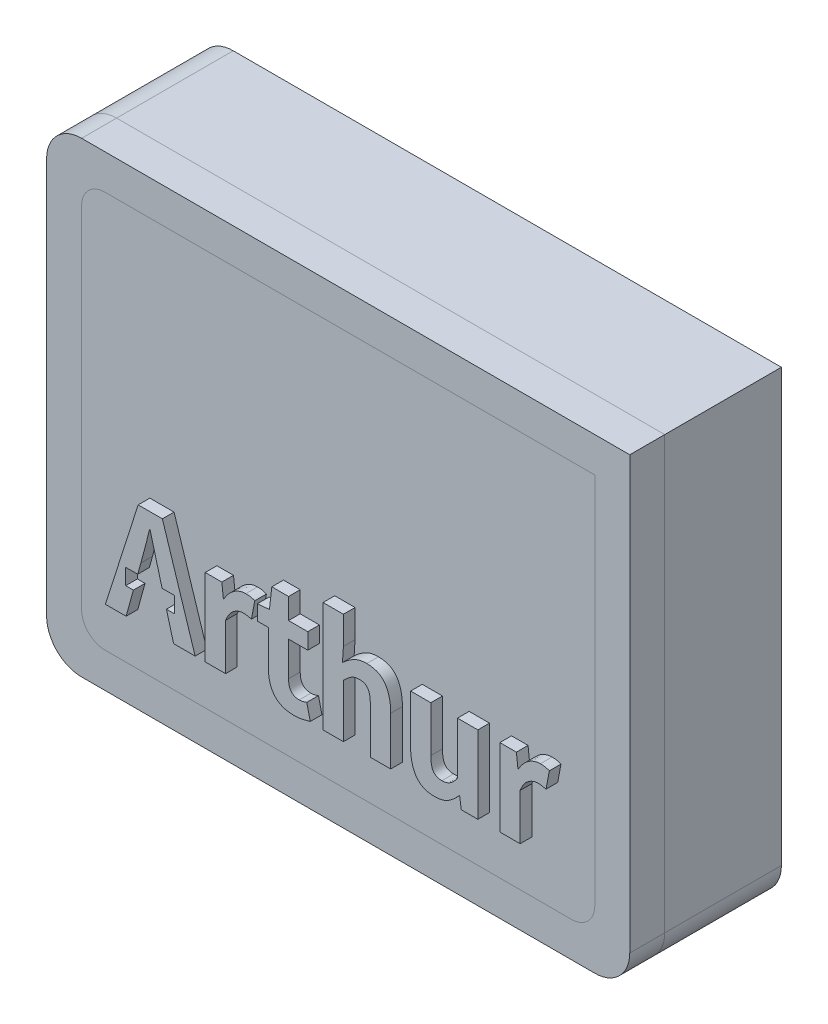
from build123d import *

# Parameters (mm, degrees)
SKETCH1_W           = 40
SKETCH1_H           = 50
BOSS_EXTRUDE1_DEPTH = 10
FILLET1_R           = 3
BOSS_EXTRUDE6_DEPTH = 3
BOSS_EXTRUDE7_DEPTH = 3
BOSS_EXTRUDE8_DEPTH = 1


# Read off the part's stored shape, not the designer's step: Boss-Extrude8
with BuildPart() as part:
    # Sketch1 → Boss-Extrude1 (new body)
    with BuildSketch(Plane(origin=(0, 0, 0), x_dir=(0, 1, 0), z_dir=(0, 0, 1))):
        with Locations((20, 25)):
            Rectangle(SKETCH1_W, SKETCH1_H)
    extrude(amount=BOSS_EXTRUDE1_DEPTH)

    # Fillet1
    fillet1_edges = [part.edges().sort_by_distance(p)[0] for p in [
        (-50, 0, 5),
        (-50, 40, 5),
        (0, 0, 5),
    ]]
    fillet(fillet1_edges, radius=FILLET1_R)

    # Sketch6 → Boss-Extrude6 (add)
    with BuildSketch(Plane.XY.offset(10)):
        with BuildLine():
            Line((-45, 3), (-5, 3))
            ThreePointArc((-5, 3), (-3.585786438, 3.585786438), (-3, 5))
            Line((-3, 5), (-3, 37))
            Line((-3, 37), (-45, 37))
            ThreePointArc((-45, 37), (-46.414213562, 36.414213562), (-47, 35))
            Line((-47, 35), (-47, 5))
            ThreePointArc((-47, 5), (-46.414213562, 3.585786438), (-45, 3))
        make_face()
    extrude(amount=BOSS_EXTRUDE6_DEPTH)


with BuildPart() as body_2:
    # Sketch7 → Boss-Extrude7 (new body)
    with BuildSketch(Plane.XY.offset(10)):
        with BuildLine():
            Line((-47, 0), (-3, 0))
            ThreePointArc((-3, 0), (-0.878679656, 0.878679656), (0, 3))
            Line((0, 3), (0, 40))
            Line((0, 40), (-47, 40))
            ThreePointArc((-47, 40), (-49.121320344, 39.121320344), (-50, 37))
            Line((-50, 37), (-50, 3))
            ThreePointArc((-50, 3), (-49.121320344, 0.878679656), (-47, 0))
        make_face()
        with BuildLine():
            Line((-3, 5), (-3, 37))
            Line((-3, 37), (-45, 37))
            ThreePointArc((-45, 37), (-46.414213562, 36.414213562), (-47, 35))
            Line((-47, 35), (-47, 5))
            ThreePointArc((-47, 5), (-46.414213562, 3.585786438), (-45, 3))
            Line((-45, 3), (-5, 3))
            ThreePointArc((-5, 3), (-3.585786438, 3.585786438), (-3, 5))
        make_face(mode=Mode.SUBTRACT)
    extrude(amount=BOSS_EXTRUDE7_DEPTH)


with BuildPart() as body_3:
    # Boss-Extrude8 outline → Boss-Extrude8 (new body)
    with BuildSketch(Plane.XY.offset(13)):
        with BuildLine():
            add(Edge.make_bspline(
                [(-6.89259969, 12.683152397), (-6.957017269, 12.679193738), (-7.089762106, 12.671036157), (-7.290146291, 12.611818206), (-7.49488722, 12.518034298), (-7.664561696, 12.410834155), (-7.799972781, 12.306065125), (-7.898935555, 12.211405082), (-7.993547787, 12.104607593), (-8.083185726, 11.984985562), (-8.168877104, 11.852405348), (-8.25088534, 11.706914177), (-8.328451971, 11.54805463), (-8.375081751, 11.436560042), (-8.399107037, 11.379114147)],
                knots=[0, 0, 0, 0, 0.091376318, 0.188298514, 0.294403757, 0.410422197, 0.472306677, 0.537207096, 0.604501323, 0.674654277, 0.749199374, 0.828459493, 0.911616356, 1, 1, 1, 1], degree=3))
            add(Edge.make_bspline(
                [(-6.180526171, 12.576770329), (-6.240494508, 12.591469924), (-6.353200575, 12.619096729), (-6.521710362, 12.653769633), (-6.698887795, 12.682154006), (-6.823816203, 12.682797887), (-6.89259969, 12.683152397)],
                knots=[0, 0, 0, 0, 0.256421959, 0.481926164, 0.714757235, 1, 1, 1, 1], degree=3))
            Line((-6.180526171, 12.576770329), (-5.895696764, 14.083277677))
            add(Edge.make_bspline(
                [(-6.667824676, 14.223976541), (-6.622611771, 14.224067447), (-6.536667113, 14.22424025), (-6.415463178, 14.214314223), (-6.307848393, 14.204396406), (-6.186006865, 14.17753054), (-6.048099991, 14.14285352), (-5.9451247, 14.102599518), (-5.895696764, 14.083277677)],
                knots=[0, 0, 0, 0, 0.17145188, 0.325910789, 0.461312007, 0.580904183, 0.798834836, 1, 1, 1, 1], degree=3))
            add(Edge.make_bspline(
                [(-8.55353262, 12.883905654), (-8.491634198, 12.987719078), (-8.371449665, 13.189287509), (-8.160741743, 13.459341734), (-7.935650026, 13.692177857), (-7.694342299, 13.882977504), (-7.444953348, 14.035867782), (-7.188237631, 14.142275835), (-6.929553112, 14.212910696), (-6.754629434, 14.220306447), (-6.667824676, 14.223976541)],
                knots=[0, 0, 0, 0, 0.149517752, 0.290309843, 0.423005613, 0.549519039, 0.670229853, 0.783853867, 0.892738861, 1, 1, 1, 1], degree=3))
            Line((-8.55353262, 12.883905654), (-8.587849416, 12.883905654))
            Line((-8.587849416, 12.883905654), (-8.719969081, 14.05925592))
            Line((-8.719969081, 14.05925592), (-10.142400278, 14.05925592))
            Line((-10.142400278, 14.05925592), (-10.142400278, 7.41724004))
            Line((-10.142400278, 7.41724004), (-8.399107037, 7.41724004))
            Line((-8.399107037, 7.41724004), (-8.399107037, 11.379114147))
        make_face()
        with BuildLine():
            add(Edge.make_bspline(
                [(-13.627270918, 8.37811033), (-13.698752826, 8.296393984), (-13.839234919, 8.135798335), (-14.066432442, 7.917006687), (-14.303819942, 7.724600401), (-14.550080163, 7.555409683), (-14.813339449, 7.415339696), (-15.101739469, 7.320895383), (-15.412618358, 7.26004457), (-15.628207662, 7.253949265), (-15.739469717, 7.250803579)],
                knots=[0, 0, 0, 0, 0.131190441, 0.257826187, 0.380697838, 0.50015742, 0.618586318, 0.739702794, 0.86566494, 1, 1, 1, 1], degree=3))
            Line((-13.627270918, 8.37811033), (-13.580943244, 8.37811033))
            Line((-13.580943244, 8.37811033), (-13.450539419, 7.41724004))
            Line((-13.450539419, 7.41724004), (-12.026392382, 7.41724004))
            Line((-12.026392382, 7.41724004), (-12.026392382, 14.05925592))
            Line((-12.026392382, 14.05925592), (-13.769685622, 14.05925592))
            Line((-13.769685622, 14.05925592), (-13.769685622, 9.575766513))
            add(Edge.make_bspline(
                [(-15.109756509, 8.745300048), (-15.044328156, 8.747236173), (-14.916883231, 8.751007461), (-14.733079868, 8.791199269), (-14.560503919, 8.850248349), (-14.399107008, 8.939095595), (-14.243706033, 9.056759591), (-14.086526413, 9.201119822), (-13.926219225, 9.376395885), (-13.823700558, 9.506969837), (-13.769685622, 9.575766513)],
                knots=[0, 0, 0, 0, 0.119252017, 0.2322856, 0.341921475, 0.451248669, 0.56693707, 0.697010787, 0.840361338, 1, 1, 1, 1], degree=3))
            add(Edge.make_bspline(
                [(-16.05861592, 10.133414449), (-16.058023989, 10.071625398), (-16.056883081, 9.952531199), (-16.046383946, 9.781371519), (-16.030425261, 9.624137616), (-16.003804738, 9.482401099), (-15.974549434, 9.353706225), (-15.933967858, 9.240762934), (-15.89116144, 9.139677685), (-15.836478831, 9.054556339), (-15.775322961, 8.980179059), (-15.704864672, 8.917329474), (-15.626844104, 8.862925157), (-15.539688286, 8.820401817), (-15.444500843, 8.785289539), (-15.34003775, 8.762135965), (-15.227371832, 8.748421199), (-15.149833697, 8.746363574), (-15.109756509, 8.745300048)],
                knots=[0, 0, 0, 0, 0.095693767, 0.184443237, 0.265545572, 0.34026652, 0.407734768, 0.469652883, 0.525961664, 0.577328674, 0.625762458, 0.674687968, 0.72309744, 0.772620839, 0.824466896, 0.879911875, 0.93792997, 1, 1, 1, 1], degree=3))
            Line((-16.05861592, 10.133414449), (-16.05861592, 14.05925592))
            Line((-16.05861592, 14.05925592), (-17.789898282, 14.05925592))
            Line((-17.789898282, 14.05925592), (-17.789898282, 9.918934474))
            add(Edge.make_bspline(
                [(-15.739469717, 7.250803579), (-15.826544304, 7.252295726), (-15.995137063, 7.255184803), (-16.238095823, 7.29111523), (-16.462962088, 7.344663589), (-16.669421832, 7.422451203), (-16.857268872, 7.522377471), (-17.028359981, 7.643130973), (-17.177832204, 7.788956893), (-17.309505003, 7.955346532), (-17.421422644, 8.142432575), (-17.522170411, 8.344847845), (-17.603271497, 8.566402406), (-17.672342183, 8.803563438), (-17.725181112, 9.058340653), (-17.761700427, 9.330148669), (-17.787231053, 9.618750914), (-17.788993171, 9.817068655), (-17.789898282, 9.918934474)],
                knots=[0, 0, 0, 0, 0.06794897, 0.13156197, 0.191364378, 0.248193502, 0.303345965, 0.35714136, 0.411160683, 0.465853587, 0.522390547, 0.581122383, 0.642186012, 0.706365777, 0.773909781, 0.845166862, 0.920470028, 1, 1, 1, 1], degree=3))
        make_face()
        with BuildLine():
            add(Edge.make_bspline(
                [(-22.177300659, 12.731195912), (-22.242711742, 12.729126624), (-22.370009185, 12.725099554), (-22.554290679, 12.686737064), (-22.727869913, 12.630347155), (-22.888566262, 12.541996693), (-23.045221356, 12.43190306), (-23.207660539, 12.302601303), (-23.380515904, 12.153172855), (-23.493988041, 12.041541848), (-23.553404182, 11.983089757)],
                knots=[0, 0, 0, 0, 0.121414917, 0.236287304, 0.348567784, 0.45937419, 0.57555246, 0.704219947, 0.845124013, 1, 1, 1, 1], degree=3))
            add(Edge.make_bspline(
                [(-21.240452127, 11.343081511), (-21.241065675, 11.404866427), (-21.242248247, 11.523952658), (-21.252460515, 11.695167203), (-21.26936722, 11.852119876), (-21.292818833, 11.994361744), (-21.323557207, 12.122342552), (-21.361037245, 12.236192347), (-21.405019296, 12.336138812), (-21.457013923, 12.42262734), (-21.518741558, 12.494979492), (-21.585651146, 12.560381334), (-21.663511507, 12.612862092), (-21.749366292, 12.656634637), (-21.843828159, 12.690807711), (-21.947519603, 12.714620788), (-22.059700251, 12.72802115), (-22.137228553, 12.730114118), (-22.177300659, 12.731195912)],
                knots=[0, 0, 0, 0, 0.09606466, 0.185158109, 0.266574784, 0.341432292, 0.409162037, 0.471033178, 0.527560202, 0.578656355, 0.62727786, 0.675087378, 0.723684477, 0.772605992, 0.824652996, 0.879446433, 0.937689396, 1, 1, 1, 1], degree=3))
            Line((-21.240452127, 11.343081511), (-21.240452127, 7.41724004))
            Line((-21.240452127, 7.41724004), (-19.497158886, 7.41724004))
            Line((-19.497158886, 7.41724004), (-19.497158886, 11.555845646))
            add(Edge.make_bspline(
                [(-21.549303291, 14.223976541), (-21.462232336, 14.222475563), (-21.293646608, 14.219569387), (-21.050638664, 14.183758555), (-20.82542209, 14.129669703), (-20.618364624, 14.053226713), (-20.431221906, 13.951835327), (-20.260416472, 13.831700435), (-20.11079448, 13.685893315), (-19.979680812, 13.518855388), (-19.8648156, 13.333405652), (-19.767567573, 13.128989358), (-19.683446251, 12.909353636), (-19.614370536, 12.671842253), (-19.562089096, 12.416974569), (-19.525316768, 12.144637227), (-19.499837008, 11.856027632), (-19.498067694, 11.657710931), (-19.497158886, 11.555845646)],
                knots=[0, 0, 0, 0, 0.067933396, 0.131531816, 0.191320516, 0.248554547, 0.303300528, 0.357083592, 0.411090534, 0.465770902, 0.522529054, 0.581051804, 0.642259671, 0.70599592, 0.773961602, 0.84520235, 0.920488256, 1, 1, 1, 1], degree=3))
            add(Edge.make_bspline(
                [(-23.635764492, 13.252811212), (-23.568992742, 13.314819481), (-23.433939969, 13.440237622), (-23.21599825, 13.615176064), (-22.981519284, 13.777173354), (-22.735742539, 13.932168154), (-22.470899212, 14.06509409), (-22.181764044, 14.15775855), (-21.872317355, 14.213409934), (-21.658782674, 14.220395193), (-21.549303291, 14.223976541)],
                knots=[0, 0, 0, 0, 0.115619274, 0.233851947, 0.354265795, 0.477139709, 0.602442212, 0.72914752, 0.86113374, 1, 1, 1, 1], degree=3))
            Line((-23.635764492, 13.252811212), (-23.553404182, 14.49679507))
            Line((-23.553404182, 14.49679507), (-23.553404182, 16.881812396))
            Line((-23.553404182, 16.881812396), (-25.296697422, 16.881812396))
            Line((-25.296697422, 16.881812396), (-25.296697422, 7.41724004))
            Line((-25.296697422, 7.41724004), (-23.553404182, 7.41724004))
            Line((-23.553404182, 7.41724004), (-23.553404182, 11.983089757))
        make_face()
        with BuildLine():
            add(Edge.make_bspline(
                [(-26.394834896, 7.499600351), (-26.491965802, 7.471801335), (-26.698586568, 7.41266615), (-26.965830719, 7.342708048), (-27.200795131, 7.294246457), (-27.392893763, 7.269416253), (-27.596224044, 7.253505056), (-27.735445784, 7.251720432), (-27.806971054, 7.250803579)],
                knots=[0, 0, 0, 0, 0.210487011, 0.447756428, 0.575349219, 0.709996817, 0.851010652, 1, 1, 1, 1], degree=3))
            Line((-26.394834896, 7.499600351), (-26.691675182, 8.769321805))
            add(Edge.make_bspline(
                [(-27.343694308, 8.626907102), (-27.287474319, 8.62942563), (-27.171776943, 8.634608612), (-27.001532055, 8.670669991), (-26.840980764, 8.717724107), (-26.739035096, 8.752954952), (-26.691675182, 8.769321805)],
                knots=[0, 0, 0, 0, 0.251439997, 0.517448487, 0.775825707, 1, 1, 1, 1], degree=3))
            add(Edge.make_bspline(
                [(-28.258236923, 9.742202974), (-28.255546346, 9.653336312), (-28.250490327, 9.486341773), (-28.206624461, 9.25389291), (-28.134242535, 9.056884048), (-28.028818706, 8.896592679), (-27.893948214, 8.773589562), (-27.731983075, 8.688151449), (-27.54599851, 8.635249894), (-27.413278045, 8.629776655), (-27.343694308, 8.626907102)],
                knots=[0, 0, 0, 0, 0.161917533, 0.304268702, 0.429383006, 0.542186936, 0.650710857, 0.758495674, 0.873382197, 1, 1, 1, 1], degree=3))
            Line((-28.258236923, 9.742202974), (-28.258236923, 12.683152397))
            Line((-28.258236923, 12.683152397), (-26.609314872, 12.683152397))
            Line((-26.609314872, 12.683152397), (-26.609314872, 14.05925592))
            Line((-26.609314872, 14.05925592), (-28.258236923, 14.05925592))
            Line((-28.258236923, 14.05925592), (-28.258236923, 15.848876835))
            Line((-28.258236923, 15.848876835), (-29.692678998, 15.848876835))
            Line((-29.692678998, 15.848876835), (-29.895148095, 14.05925592))
            Line((-29.895148095, 14.05925592), (-30.926367817, 13.975179769))
            Line((-30.926367817, 13.975179769), (-30.926367817, 12.683152397))
            Line((-30.926367817, 12.683152397), (-29.989519284, 12.683152397))
            Line((-29.989519284, 12.683152397), (-29.989519284, 9.730192095))
            add(Edge.make_bspline(
                [(-27.806971054, 7.250803579), (-27.870472757, 7.25195887), (-27.994765988, 7.254220146), (-28.177188434, 7.267013075), (-28.350090956, 7.293314677), (-28.513867356, 7.327830927), (-28.669040189, 7.369223443), (-28.813368529, 7.42556031), (-28.949981484, 7.488458716), (-29.117668298, 7.586318489), (-29.306693681, 7.730722003), (-29.500075982, 7.937384773), (-29.661537779, 8.172057817), (-29.784563691, 8.438676789), (-29.875256404, 8.730077468), (-29.942381425, 9.043604756), (-29.981710013, 9.379734747), (-29.986866049, 9.611122615), (-29.989519284, 9.730192095)],
                knots=[0, 0, 0, 0, 0.050409548, 0.098667678, 0.145021988, 0.18909492, 0.231499619, 0.272306833, 0.311909423, 0.350763364, 0.426217389, 0.499762626, 0.57455825, 0.651322874, 0.731865898, 0.816364893, 0.90550353, 1, 1, 1, 1], degree=3))
        make_face()
        with BuildLine():
            add(Edge.make_bspline(
                [(-32.149761597, 12.683152397), (-32.214179176, 12.679193738), (-32.346924013, 12.671036157), (-32.547308199, 12.611818206), (-32.752049127, 12.518034298), (-32.921723603, 12.410834155), (-33.057134688, 12.306065125), (-33.156097463, 12.211405082), (-33.250709694, 12.104607593), (-33.340347633, 11.984985562), (-33.426039012, 11.852405348), (-33.508047247, 11.706914177), (-33.585613878, 11.54805463), (-33.632243658, 11.436560042), (-33.656268945, 11.379114147)],
                knots=[0, 0, 0, 0, 0.091376318, 0.188298514, 0.294403757, 0.410422197, 0.472306677, 0.537207096, 0.604501323, 0.674654277, 0.749199374, 0.828459493, 0.911616356, 1, 1, 1, 1], degree=3))
            add(Edge.make_bspline(
                [(-31.437688079, 12.576770329), (-31.497656415, 12.591469924), (-31.610362483, 12.619096729), (-31.77887227, 12.653769633), (-31.956049702, 12.682154006), (-32.080978111, 12.682797887), (-32.149761597, 12.683152397)],
                knots=[0, 0, 0, 0, 0.256421959, 0.481926164, 0.714757235, 1, 1, 1, 1], degree=3))
            Line((-31.437688079, 12.576770329), (-31.152858671, 14.083277677))
            add(Edge.make_bspline(
                [(-31.924986583, 14.223976541), (-31.879773679, 14.224067447), (-31.793829021, 14.22424025), (-31.672625085, 14.214314223), (-31.5650103, 14.204396406), (-31.443168773, 14.17753054), (-31.305261898, 14.14285352), (-31.202286607, 14.102599518), (-31.152858671, 14.083277677)],
                knots=[0, 0, 0, 0, 0.17145188, 0.325910789, 0.461312007, 0.580904183, 0.798834836, 1, 1, 1, 1], degree=3))
            add(Edge.make_bspline(
                [(-33.810694527, 12.883905654), (-33.748796105, 12.987719078), (-33.628611572, 13.189287509), (-33.41790365, 13.459341734), (-33.192811933, 13.692177857), (-32.951504206, 13.882977504), (-32.702115255, 14.035867782), (-32.445399539, 14.142275835), (-32.186715019, 14.212910696), (-32.011791341, 14.220306447), (-31.924986583, 14.223976541)],
                knots=[0, 0, 0, 0, 0.149517752, 0.290309843, 0.423005613, 0.549519039, 0.670229853, 0.783853867, 0.892738861, 1, 1, 1, 1], degree=3))
            Line((-33.810694527, 12.883905654), (-33.845011323, 12.883905654))
            Line((-33.845011323, 12.883905654), (-33.977130988, 14.05925592))
            Line((-33.977130988, 14.05925592), (-35.399562185, 14.05925592))
            Line((-35.399562185, 14.05925592), (-35.399562185, 7.41724004))
            Line((-35.399562185, 7.41724004), (-33.656268945, 7.41724004))
            Line((-33.656268945, 7.41724004), (-33.656268945, 11.379114147))
        make_face()
        with BuildLine():
            add(Edge.make_bspline(
                [(-40.178176038, 14.865700627), (-40.23510149, 14.626418602), (-40.350268695, 14.142321581), (-40.538642295, 13.419515089), (-40.731787001, 12.702281173), (-40.860962003, 12.228423125), (-40.924566352, 11.995100636)],
                knots=[0, 0, 0, 0, 0.248753908, 0.503259809, 0.755410596, 1, 1, 1, 1], degree=3))
            Line((-40.178176038, 14.865700627), (-40.130132523, 14.865700627))
            add(Edge.make_bspline(
                [(-39.359720451, 11.995100636), (-39.42660832, 12.228724712), (-39.562458509, 12.703218451), (-39.746725547, 13.425152949), (-39.927472324, 14.150816978), (-40.063101648, 14.629249281), (-40.130132523, 14.865700627)],
                knots=[0, 0, 0, 0, 0.245258339, 0.498123089, 0.751961834, 1, 1, 1, 1], degree=3))
            Line((-39.359720451, 11.995100636), (-39.098254248, 11.034230346))
            Line((-39.098254248, 11.034230346), (-38.043671322, 11.034230346))
            Line((-38.043671322, 11.034230346), (-38.043671322, 9.670137702))
            Line((-38.043671322, 9.670137702), (-38.72706562, 9.670137702))
            Line((-38.72706562, 9.670137702), (-38.114020754, 7.41724004))
            Line((-38.114020754, 7.41724004), (-36.264345446, 7.41724004))
            Line((-36.264345446, 7.41724004), (-39.074891044, 16.205771514))
            Line((-39.074891044, 16.205771514), (-41.151057206, 16.205771514))
            Line((-41.151057206, 16.205771514), (-43.961602804, 7.41724004))
            Line((-43.961602804, 7.41724004), (-42.182276928, 7.41724004))
            Line((-42.182276928, 7.41724004), (-41.563321161, 9.670137702))
            Line((-41.563321161, 9.670137702), (-42.218309564, 9.670137702))
            Line((-42.218309564, 9.670137702), (-42.218309564, 11.034230346))
            Line((-42.218309564, 11.034230346), (-41.188553579, 11.034230346))
            Line((-41.188553579, 11.034230346), (-40.924566352, 11.995100636))
        make_face()
    extrude(amount=BOSS_EXTRUDE8_DEPTH)


solid = Compound([part.part, body_2.part, body_3.part])
